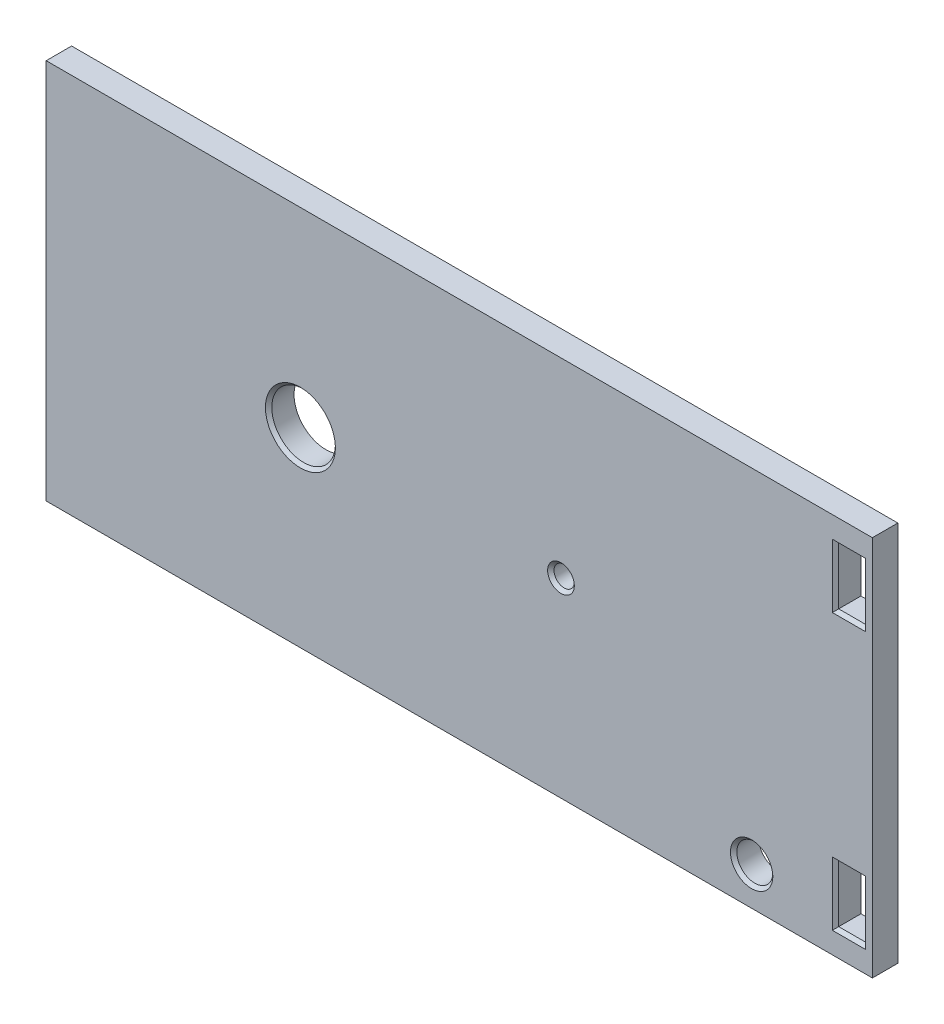
from build123d import *

# Parameters (mm, degrees)
SKETCH1_W           = 130
SKETCH1_H           = 60
SKETCH1_R           = 5
SKETCH1_R_2         = 2.83
SKETCH1_R_3         = 1.6
SKETCH1_W_2         = 4.2
SKETCH1_H_2         = 9
BOSS_EXTRUDE1_DEPTH = 2
CHAMFER1_SIZE       = 0.5


with BuildPart() as part:
    # Sketch1 → Boss-Extrude1 (new, symmetric)
    with BuildSketch(Plane.XY):
        Rectangle(SKETCH1_W, SKETCH1_H)
        with Locations((-25, 0)):
            Circle(SKETCH1_R, mode=Mode.SUBTRACT)
        with Locations((46, -24)):
            Circle(SKETCH1_R_2, mode=Mode.SUBTRACT)
        with Locations((16, 0)):
            Circle(SKETCH1_R_3, mode=Mode.SUBTRACT)
        with Locations((61.3, 21.65)):
            Rectangle(SKETCH1_W_2, SKETCH1_H_2, mode=Mode.SUBTRACT)
        with Locations((61.3, -21.65)):
            Rectangle(SKETCH1_W_2, SKETCH1_H_2, mode=Mode.SUBTRACT)
    extrude(amount=BOSS_EXTRUDE1_DEPTH, both=True)

    # Chamfer1
    chamfer1_edges = [part.edges().sort_by_distance(p)[0] for p in [
        (61.3, 17.15, 2),
        (59.2, 21.65, 2),
        (61.3, 26.15, 2),
        (63.4, 21.65, 2),
        (-30, 0, 2),
        (43.17, -24, 2),
        (61.3, -26.15, 2),
        (59.2, -21.65, 2),
        (61.3, -17.15, 2),
        (63.4, -21.65, 2),
        (14.4, 0, 2),
    ]]
    chamfer(chamfer1_edges, length=CHAMFER1_SIZE)


solid = part.part
